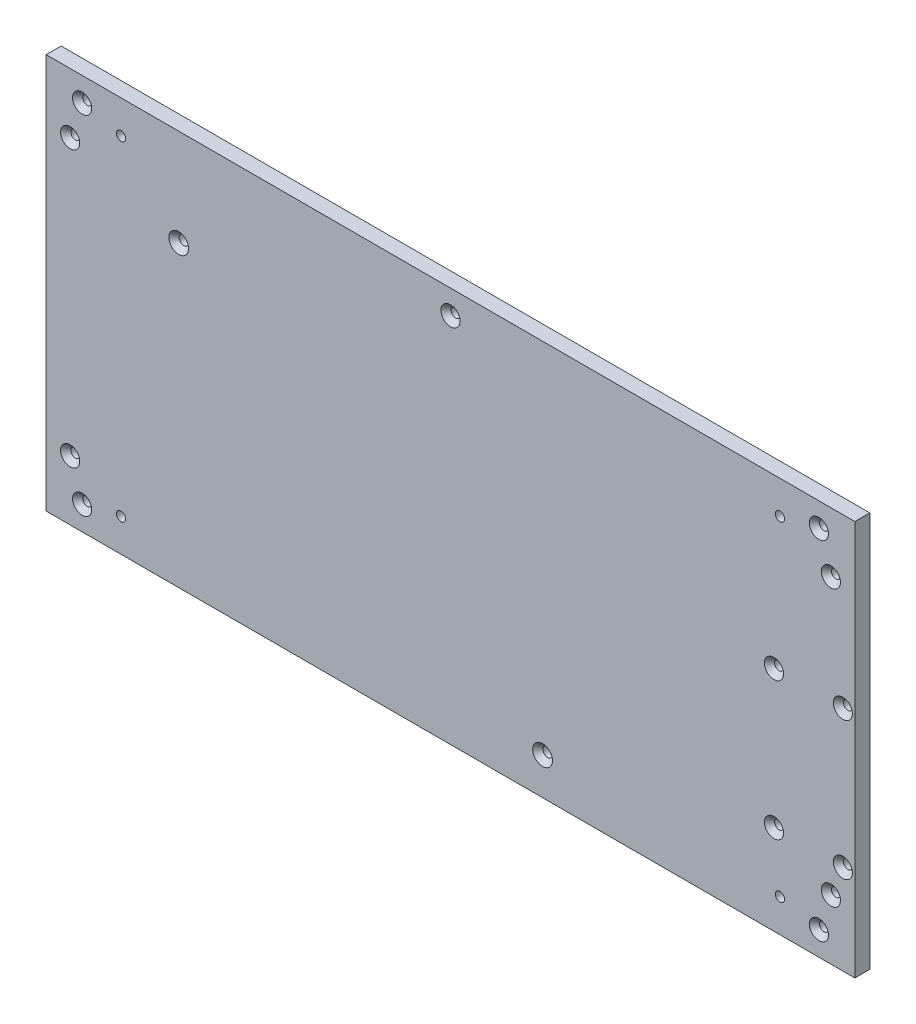
from build123d import *

# Parameters (mm, degrees)
SKETCH1_W            = 270
SKETCH1_H            = 132
BASE_DEPTH           = 2.5
SKETCH2_R            = 1.5
FASTENERSHOLES_DEPTH = 151.352918163
SKETCH3_R            = 1.6
PSUMOUNT_DEPTH       = 151.352918163
SKETCH4_R            = 1.5
INTERFACEHOLES_DEPTH = 151.352918163
CHAMFERALL_SIZE      = 1.7
SKETCH5_R            = 1.55
CUT_EXTRUDE2_DEPTH   = 151.352918163


with BuildPart() as part:
    # Sketch1 → Base (new, symmetric)
    with BuildSketch(Plane.XY):
        Rectangle(SKETCH1_W, SKETCH1_H)
    extrude(amount=BASE_DEPTH, both=True)

    # Sketch2 → FastenersHoles (cut, through all)
    with BuildSketch(Plane.XY.offset(2.5)):
        with Locations((-127, -46)):
            Circle(SKETCH2_R)
        with Locations((-123, -58)):
            Circle(SKETCH2_R)
        with Locations((-127, 46)):
            Circle(SKETCH2_R)
        with Locations((-123, 58)):
            Circle(SKETCH2_R)
        with Locations((0, 58)):
            Circle(SKETCH2_R)
        with Locations((123, -58)):
            Circle(SKETCH2_R)
        with Locations((127, -46)):
            Circle(SKETCH2_R)
        with Locations((127, 46)):
            Circle(SKETCH2_R)
        with Locations((123, 58)):
            Circle(SKETCH2_R)
    extrude(amount=-FASTENERSHOLES_DEPTH, mode=Mode.SUBTRACT)

    # Sketch3 → PSUMount (cut, through all)
    with BuildSketch(Plane(origin=(0, 0, -2.5), x_dir=(-1, 0, 0), z_dir=(0, 0, -1))):
        with Locations((-30.75, -53.65)):
            Circle(SKETCH3_R)
        with Locations((90.75, 33.65)):
            Circle(SKETCH3_R)
    extrude(amount=-PSUMOUNT_DEPTH, mode=Mode.SUBTRACT)

    # Sketch4 → InterfaceHoles (cut, through all)
    with BuildSketch(Plane.XY.offset(2.5)):
        with Locations((108, 10)):
            Circle(SKETCH4_R)
        with Locations((131, 10)):
            Circle(SKETCH4_R)
        with Locations((108, -36)):
            Circle(SKETCH4_R)
        with Locations((131, -36)):
            Circle(SKETCH4_R)
    extrude(amount=-INTERFACEHOLES_DEPTH, mode=Mode.SUBTRACT)

    # ChamferAll
    chamferall_edges = [part.edges().sort_by_distance(p)[0] for p in [
        (32.35, -53.65, 2.5),
        (-124.5, -58, 2.5),
        (-128.5, -46, 2.5),
        (-124.5, 58, 2.5),
        (-128.5, 46, 2.5),
        (-89.15, 33.65, 2.5),
        (-1.5, 58, 2.5),
        (121.5, 58, 2.5),
        (125.5, 46, 2.5),
        (125.5, -46, 2.5),
        (121.5, -58, 2.5),
        (129.5, 10, 2.5),
        (129.5, -36, 2.5),
        (106.5, -36, 2.5),
        (106.5, 10, 2.5),
    ]]
    chamfer(chamferall_edges, length=CHAMFERALL_SIZE)

    # Sketch5 → Cut-Extrude2 (cut, through all)
    with BuildSketch(Plane.XY.offset(2.5)):
        with Locations((-110, -55)):
            Circle(SKETCH5_R)
        with Locations((-110, 55)):
            Circle(SKETCH5_R)
        with Locations((110, 55)):
            Circle(SKETCH5_R)
        with Locations((110, -55)):
            Circle(SKETCH5_R)
    extrude(amount=-CUT_EXTRUDE2_DEPTH, mode=Mode.SUBTRACT)


solid = part.part
